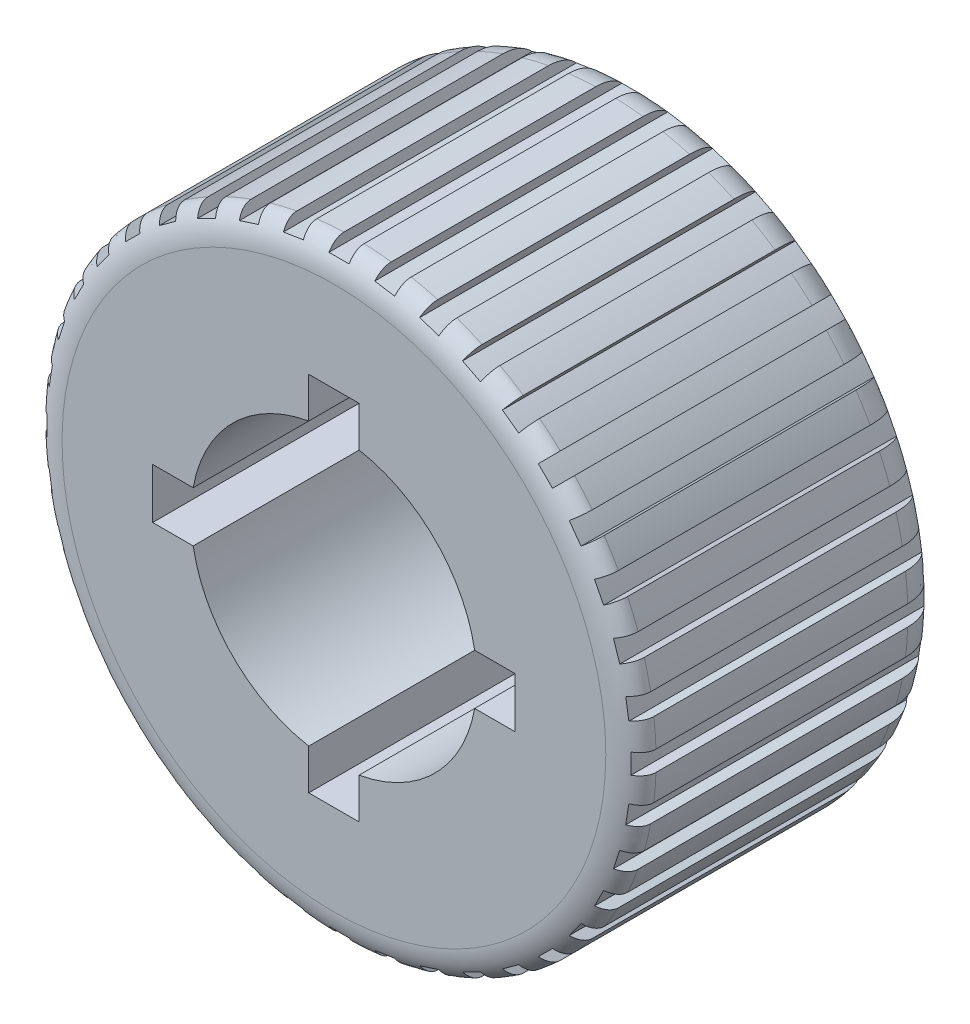
from build123d import *

# Parameters (mm, degrees)
ESBO_O1_R                = 30
ESBO_O1_R_2              = 10.7
RESSALTO_EXTRUS_O1_DEPTH = 30
ESBO_O2_R                = 14.2
ESBO_O2_R_2              = 10.7
CORTE_EXTRUS_O1_DEPTH    = 52.961524227
FILETE2_SIZE             = 2
FILETE2_SIZE_2           = 3
CORTE_EXTRUS_O2_DEPTH    = 52.9615244
CORTE_EXTRUS_O3_DEPTH    = 52.942275826


with BuildPart() as part:
    # Esboço1 → Ressalto-extrusão1 (new body)
    with BuildSketch(Plane.XY):
        Circle(ESBO_O1_R)
        Circle(ESBO_O1_R_2, mode=Mode.SUBTRACT)
    extrude(amount=RESSALTO_EXTRUS_O1_DEPTH)

    # Esboço2 → Corte-extrusão1 (cut, through all)
    with BuildSketch(Plane(origin=(0, 0, 0), x_dir=(-1, 0, 0), z_dir=(0, 0, -1))):
        Circle(ESBO_O2_R)
        Circle(ESBO_O2_R_2, mode=Mode.SUBTRACT)
    extrude(amount=-CORTE_EXTRUS_O1_DEPTH, mode=Mode.SUBTRACT)

    # Filete2
    # an asymmetric fillet: 3, 2 mm, written as the material it takes off along each edge
    with BuildSketch(Plane(origin=(0, 0, 30), x_dir=(1, 0, 0), z_dir=(0, -1, 0))) as filete2_piece_1:
        with BuildLine():
            Bezier((30, -FILETE2_SIZE), (30, 0), (30 - FILETE2_SIZE_2, 0), weights=[1, 0.707106781, 1])
            Line((30 - FILETE2_SIZE_2, 0), (30, 0))
            Line((30, 0), (30, -FILETE2_SIZE))
        make_face()
    revolve(axis=Axis((0, 0, 30), (0, 0, 1)), mode=Mode.SUBTRACT)
    with BuildSketch(Plane(origin=(0, 0, 0), x_dir=(1, 0, 0), z_dir=(0, -1, 0))) as filete2_piece_2:
        with BuildLine():
            Bezier((30, FILETE2_SIZE_2), (30, 0), (30 - FILETE2_SIZE, 0), weights=[1, 0.707106781, 1])
            Line((30 - FILETE2_SIZE, 0), (30, 0))
            Line((30, 0), (30, FILETE2_SIZE_2))
        make_face()
    revolve(axis=Axis((0, 0, 0), (0, 0, 1)), mode=Mode.SUBTRACT)

    # Esboço6 → Corte-extrusão2 (cut, through all)
    with BuildSketch(Plane.XY.offset(30)):
        with BuildLine():
            Line((5.521589879, 28.469493238), (5.678114326, 29.457749705))
            ThreePointArc((5.678114326, 29.457749705), (4.693033951, 29.630650218), (3.702737645, 29.770618635))
            Line((3.702737645, 29.770618635), (3.546213197, 28.782362168))
            ThreePointArc((3.546213197, 28.782362168), (4.536599486, 28.642961877), (5.521589879, 28.469493238))
        make_face()
        with BuildLine():
            Line((-1, 29.983328701), (-1, 28.982753492))
            ThreePointArc((-1, 28.982753492), (0, 29), (1, 28.982753492))
            Line((1, 28.982753492), (1, 29.983328701))
            ThreePointArc((1, 29.983328701), (0, 30), (-1, 29.983328701))
        make_face()
        with BuildLine():
            Line((9.907219889, 27.255219575), (10.216414633, 28.206823147))
            ThreePointArc((10.216414633, 28.206823147), (9.270509831, 28.531695489), (8.3143016, 28.824857136))
            Line((8.3143016, 28.824857136), (8.005106857, 27.873253563))
            ThreePointArc((8.005106857, 27.873253563), (8.961492837, 27.580638973), (9.907219889, 27.255219575))
        make_face()
        with BuildLine():
            Line((14.048901266, 25.369831951), (14.503152905, 26.26135099))
            ThreePointArc((14.503152905, 26.26135099), (13.619714992, 26.730195726), (12.721139857, 27.169331989))
            Line((12.721139857, 27.169331989), (12.266888218, 26.27781295))
            ThreePointArc((12.266888218, 26.27781295), (13.165724492, 25.839189201), (14.048901266, 25.369831951))
        make_face()
        with BuildLine():
            Line((17.844652068, 22.859754867), (18.43277542, 23.669237215))
            ThreePointArc((18.43277542, 23.669237215), (17.633557569, 24.270509831), (16.814741431, 24.844807719))
            Line((16.814741431, 24.844807719), (16.226618079, 24.035325371))
            ThreePointArc((16.226618079, 24.035325371), (17.045772316, 23.461492837), (17.844652068, 22.859754867))
        make_face()
        with BuildLine():
            Line((21.201008313, 19.786794751), (21.908521828, 20.494308266))
            ThreePointArc((21.908521828, 20.494308266), (21.213203436, 21.213203436), (20.494308266, 21.908521828))
            Line((20.494308266, 21.908521828), (19.786794751, 21.201008313))
            ThreePointArc((19.786794751, 21.201008313), (20.506096654, 20.506096654), (21.201008313, 19.786794751))
        make_face()
        with BuildLine():
            Line((24.035325371, 16.226618079), (24.844807719, 16.814741431))
            ThreePointArc((24.844807719, 16.814741431), (24.270509831, 17.633557569), (23.669237215, 18.43277542))
            Line((23.669237215, 18.43277542), (22.859754867, 17.844652068))
            ThreePointArc((22.859754867, 17.844652068), (23.461492837, 17.045772316), (24.035325371, 16.226618079))
        make_face()
        with BuildLine():
            Line((26.27781295, 12.266888218), (27.169331989, 12.721139857))
            ThreePointArc((27.169331989, 12.721139857), (26.730195726, 13.619714992), (26.26135099, 14.503152905))
            Line((26.26135099, 14.503152905), (25.369831951, 14.048901266))
            ThreePointArc((25.369831951, 14.048901266), (25.839189201, 13.165724492), (26.27781295, 12.266888218))
        make_face()
        with BuildLine():
            Line((27.873253563, 8.005106857), (28.824857136, 8.3143016))
            ThreePointArc((28.824857136, 8.3143016), (28.531695489, 9.270509831), (28.206823147, 10.216414633))
            Line((28.206823147, 10.216414633), (27.255219575, 9.907219889))
            ThreePointArc((27.255219575, 9.907219889), (27.580638973, 8.961492837), (27.873253563, 8.005106857))
        make_face()
        with BuildLine():
            Line((28.782362168, 3.546213197), (29.770618635, 3.702737645))
            ThreePointArc((29.770618635, 3.702737645), (29.630650218, 4.693033951), (29.457749705, 5.678114326))
            Line((29.457749705, 5.678114326), (28.469493238, 5.521589879))
            ThreePointArc((28.469493238, 5.521589879), (28.642961877, 4.536599486), (28.782362168, 3.546213197))
        make_face()
        with BuildLine():
            Line((28.982753492, -1), (29.983328701, -1))
            ThreePointArc((29.983328701, -1), (30, 0), (29.983328701, 1))
            Line((29.983328701, 1), (28.982753492, 1))
            ThreePointArc((28.982753492, 1), (29, 0), (28.982753492, -1))
        make_face()
        with BuildLine():
            Line((28.469493238, -5.521589879), (29.457749705, -5.678114326))
            ThreePointArc((29.457749705, -5.678114326), (29.630650218, -4.693033951), (29.770618635, -3.702737645))
            Line((29.770618635, -3.702737645), (28.782362168, -3.546213197))
            ThreePointArc((28.782362168, -3.546213197), (28.642961877, -4.536599486), (28.469493238, -5.521589879))
        make_face()
        with BuildLine():
            Line((27.255219575, -9.907219889), (28.206823147, -10.216414633))
            ThreePointArc((28.206823147, -10.216414633), (28.531695489, -9.270509831), (28.824857136, -8.3143016))
            Line((28.824857136, -8.3143016), (27.873253563, -8.005106857))
            ThreePointArc((27.873253563, -8.005106857), (27.580638973, -8.961492837), (27.255219575, -9.907219889))
        make_face()
        with BuildLine():
            Line((25.369831951, -14.048901266), (26.26135099, -14.503152905))
            ThreePointArc((26.26135099, -14.503152905), (26.730195726, -13.619714992), (27.169331989, -12.721139857))
            Line((27.169331989, -12.721139857), (26.27781295, -12.266888218))
            ThreePointArc((26.27781295, -12.266888218), (25.839189201, -13.165724492), (25.369831951, -14.048901266))
        make_face()
        with BuildLine():
            Line((22.859754867, -17.844652068), (23.669237215, -18.43277542))
            ThreePointArc((23.669237215, -18.43277542), (24.270509831, -17.633557569), (24.844807719, -16.814741431))
            Line((24.844807719, -16.814741431), (24.035325371, -16.226618079))
            ThreePointArc((24.035325371, -16.226618079), (23.461492837, -17.045772316), (22.859754867, -17.844652068))
        make_face()
        with BuildLine():
            Line((19.786794751, -21.201008313), (20.494308266, -21.908521828))
            ThreePointArc((20.494308266, -21.908521828), (21.213203436, -21.213203436), (21.908521828, -20.494308266))
            Line((21.908521828, -20.494308266), (21.201008313, -19.786794751))
            ThreePointArc((21.201008313, -19.786794751), (20.506096654, -20.506096654), (19.786794751, -21.201008313))
        make_face()
        with BuildLine():
            Line((16.226618079, -24.035325371), (16.814741431, -24.844807719))
            ThreePointArc((16.814741431, -24.844807719), (17.633557569, -24.270509831), (18.43277542, -23.669237215))
            Line((18.43277542, -23.669237215), (17.844652068, -22.859754867))
            ThreePointArc((17.844652068, -22.859754867), (17.045772316, -23.461492837), (16.226618079, -24.035325371))
        make_face()
        with BuildLine():
            Line((12.266888218, -26.27781295), (12.721139857, -27.169331989))
            ThreePointArc((12.721139857, -27.169331989), (13.619714992, -26.730195726), (14.503152905, -26.26135099))
            Line((14.503152905, -26.26135099), (14.048901266, -25.369831951))
            ThreePointArc((14.048901266, -25.369831951), (13.165724492, -25.839189201), (12.266888218, -26.27781295))
        make_face()
        with BuildLine():
            Line((8.005106857, -27.873253563), (8.3143016, -28.824857136))
            ThreePointArc((8.3143016, -28.824857136), (9.270509831, -28.531695489), (10.216414633, -28.206823147))
            Line((10.216414633, -28.206823147), (9.907219889, -27.255219575))
            ThreePointArc((9.907219889, -27.255219575), (8.961492837, -27.580638973), (8.005106857, -27.873253563))
        make_face()
        with BuildLine():
            Line((3.546213197, -28.782362168), (3.702737645, -29.770618635))
            ThreePointArc((3.702737645, -29.770618635), (4.693033951, -29.630650218), (5.678114326, -29.457749705))
            Line((5.678114326, -29.457749705), (5.521589879, -28.469493238))
            ThreePointArc((5.521589879, -28.469493238), (4.536599486, -28.642961877), (3.546213197, -28.782362168))
        make_face()
        with BuildLine():
            Line((-1, -28.982753492), (-1, -29.983328701))
            ThreePointArc((-1, -29.983328701), (0, -30), (1, -29.983328701))
            Line((1, -29.983328701), (1, -28.982753492))
            ThreePointArc((1, -28.982753492), (0, -29), (-1, -28.982753492))
        make_face()
        with BuildLine():
            Line((-5.521589879, -28.469493238), (-5.678114326, -29.457749705))
            ThreePointArc((-5.678114326, -29.457749705), (-4.693033951, -29.630650218), (-3.702737645, -29.770618635))
            Line((-3.702737645, -29.770618635), (-3.546213197, -28.782362168))
            ThreePointArc((-3.546213197, -28.782362168), (-4.536599486, -28.642961877), (-5.521589879, -28.469493238))
        make_face()
        with BuildLine():
            Line((-9.907219889, -27.255219575), (-10.216414633, -28.206823147))
            ThreePointArc((-10.216414633, -28.206823147), (-9.270509831, -28.531695489), (-8.3143016, -28.824857136))
            Line((-8.3143016, -28.824857136), (-8.005106857, -27.873253563))
            ThreePointArc((-8.005106857, -27.873253563), (-8.961492837, -27.580638973), (-9.907219889, -27.255219575))
        make_face()
        with BuildLine():
            Line((-14.048901266, -25.369831951), (-14.503152905, -26.26135099))
            ThreePointArc((-14.503152905, -26.26135099), (-13.619714992, -26.730195726), (-12.721139857, -27.169331989))
            Line((-12.721139857, -27.169331989), (-12.266888218, -26.27781295))
            ThreePointArc((-12.266888218, -26.27781295), (-13.165724492, -25.839189201), (-14.048901266, -25.369831951))
        make_face()
        with BuildLine():
            Line((-17.844652068, -22.859754867), (-18.43277542, -23.669237215))
            ThreePointArc((-18.43277542, -23.669237215), (-17.633557569, -24.270509831), (-16.814741431, -24.844807719))
            Line((-16.814741431, -24.844807719), (-16.226618079, -24.035325371))
            ThreePointArc((-16.226618079, -24.035325371), (-17.045772316, -23.461492837), (-17.844652068, -22.859754867))
        make_face()
        with BuildLine():
            Line((-21.201008313, -19.786794751), (-21.908521828, -20.494308266))
            ThreePointArc((-21.908521828, -20.494308266), (-21.213203436, -21.213203436), (-20.494308266, -21.908521828))
            Line((-20.494308266, -21.908521828), (-19.786794751, -21.201008313))
            ThreePointArc((-19.786794751, -21.201008313), (-20.506096654, -20.506096654), (-21.201008313, -19.786794751))
        make_face()
        with BuildLine():
            Line((-24.035325371, -16.226618079), (-24.844807719, -16.814741431))
            ThreePointArc((-24.844807719, -16.814741431), (-24.270509831, -17.633557569), (-23.669237215, -18.43277542))
            Line((-23.669237215, -18.43277542), (-22.859754867, -17.844652068))
            ThreePointArc((-22.859754867, -17.844652068), (-23.461492837, -17.045772316), (-24.035325371, -16.226618079))
        make_face()
        with BuildLine():
            Line((-26.27781295, -12.266888218), (-27.169331989, -12.721139857))
            ThreePointArc((-27.169331989, -12.721139857), (-26.730195726, -13.619714992), (-26.26135099, -14.503152905))
            Line((-26.26135099, -14.503152905), (-25.369831951, -14.048901266))
            ThreePointArc((-25.369831951, -14.048901266), (-25.839189201, -13.165724492), (-26.27781295, -12.266888218))
        make_face()
        with BuildLine():
            Line((-27.873253563, -8.005106857), (-28.824857136, -8.3143016))
            ThreePointArc((-28.824857136, -8.3143016), (-28.531695489, -9.270509831), (-28.206823147, -10.216414633))
            Line((-28.206823147, -10.216414633), (-27.255219575, -9.907219889))
            ThreePointArc((-27.255219575, -9.907219889), (-27.580638973, -8.961492837), (-27.873253563, -8.005106857))
        make_face()
        with BuildLine():
            Line((-28.782362168, -3.546213197), (-29.770618635, -3.702737645))
            ThreePointArc((-29.770618635, -3.702737645), (-29.630650218, -4.693033951), (-29.457749705, -5.678114326))
            Line((-29.457749705, -5.678114326), (-28.469493238, -5.521589879))
            ThreePointArc((-28.469493238, -5.521589879), (-28.642961877, -4.536599486), (-28.782362168, -3.546213197))
        make_face()
        with BuildLine():
            Line((-28.982753492, 1), (-29.983328701, 1))
            ThreePointArc((-29.983328701, 1), (-30, 0), (-29.983328701, -1))
            Line((-29.983328701, -1), (-28.982753492, -1))
            ThreePointArc((-28.982753492, -1), (-29, 0), (-28.982753492, 1))
        make_face()
        with BuildLine():
            Line((-28.469493238, 5.521589879), (-29.457749705, 5.678114326))
            ThreePointArc((-29.457749705, 5.678114326), (-29.630650218, 4.693033951), (-29.770618635, 3.702737645))
            Line((-29.770618635, 3.702737645), (-28.782362168, 3.546213197))
            ThreePointArc((-28.782362168, 3.546213197), (-28.642961877, 4.536599486), (-28.469493238, 5.521589879))
        make_face()
        with BuildLine():
            Line((-27.255219575, 9.907219889), (-28.206823147, 10.216414633))
            ThreePointArc((-28.206823147, 10.216414633), (-28.531695489, 9.270509831), (-28.824857136, 8.3143016))
            Line((-28.824857136, 8.3143016), (-27.873253563, 8.005106857))
            ThreePointArc((-27.873253563, 8.005106857), (-27.580638973, 8.961492837), (-27.255219575, 9.907219889))
        make_face()
        with BuildLine():
            Line((-25.369831951, 14.048901266), (-26.26135099, 14.503152905))
            ThreePointArc((-26.26135099, 14.503152905), (-26.730195726, 13.619714992), (-27.169331989, 12.721139857))
            Line((-27.169331989, 12.721139857), (-26.27781295, 12.266888218))
            ThreePointArc((-26.27781295, 12.266888218), (-25.839189201, 13.165724492), (-25.369831951, 14.048901266))
        make_face()
        with BuildLine():
            Line((-22.859754867, 17.844652068), (-23.669237215, 18.43277542))
            ThreePointArc((-23.669237215, 18.43277542), (-24.270509831, 17.633557569), (-24.844807719, 16.814741431))
            Line((-24.844807719, 16.814741431), (-24.035325371, 16.226618079))
            ThreePointArc((-24.035325371, 16.226618079), (-23.461492837, 17.045772316), (-22.859754867, 17.844652068))
        make_face()
        with BuildLine():
            Line((-19.786794751, 21.201008313), (-20.494308266, 21.908521828))
            ThreePointArc((-20.494308266, 21.908521828), (-21.213203436, 21.213203436), (-21.908521828, 20.494308266))
            Line((-21.908521828, 20.494308266), (-21.201008313, 19.786794751))
            ThreePointArc((-21.201008313, 19.786794751), (-20.506096654, 20.506096654), (-19.786794751, 21.201008313))
        make_face()
        with BuildLine():
            Line((-16.226618079, 24.035325371), (-16.814741431, 24.844807719))
            ThreePointArc((-16.814741431, 24.844807719), (-17.633557569, 24.270509831), (-18.43277542, 23.669237215))
            Line((-18.43277542, 23.669237215), (-17.844652068, 22.859754867))
            ThreePointArc((-17.844652068, 22.859754867), (-17.045772316, 23.461492837), (-16.226618079, 24.035325371))
        make_face()
        with BuildLine():
            Line((-12.266888218, 26.27781295), (-12.721139857, 27.169331989))
            ThreePointArc((-12.721139857, 27.169331989), (-13.619714992, 26.730195726), (-14.503152905, 26.26135099))
            Line((-14.503152905, 26.26135099), (-14.048901266, 25.369831951))
            ThreePointArc((-14.048901266, 25.369831951), (-13.165724492, 25.839189201), (-12.266888218, 26.27781295))
        make_face()
        with BuildLine():
            Line((-8.005106857, 27.873253563), (-8.3143016, 28.824857136))
            ThreePointArc((-8.3143016, 28.824857136), (-9.270509831, 28.531695489), (-10.216414633, 28.206823147))
            Line((-10.216414633, 28.206823147), (-9.907219889, 27.255219575))
            ThreePointArc((-9.907219889, 27.255219575), (-8.961492837, 27.580638973), (-8.005106857, 27.873253563))
        make_face()
        with BuildLine():
            Line((-3.546213197, 28.782362168), (-3.702737645, 29.770618635))
            ThreePointArc((-3.702737645, 29.770618635), (-4.693033951, 29.630650218), (-5.678114326, 29.457749705))
            Line((-5.678114326, 29.457749705), (-5.521589879, 28.469493238))
            ThreePointArc((-5.521589879, 28.469493238), (-4.536599486, 28.642961877), (-3.546213197, 28.782362168))
        make_face()
    extrude(amount=-CORTE_EXTRUS_O2_DEPTH, mode=Mode.SUBTRACT)

    # Esboço7 → Corte-extrusão3 (cut, through all)
    with BuildSketch(Plane(origin=(0, 0, 0), x_dir=(-1, 0, 0), z_dir=(0, 0, -1))):
        with BuildLine():
            Line((18, 0), (18, 2.5))
            Line((18, 2.5), (13.978197309, 2.5))
            ThreePointArc((13.978197309, 2.5), (14.2, 0), (13.978197309, -2.5))
            Line((13.978197309, -2.5), (18, -2.5))
            Line((18, -2.5), (18, 0))
        make_face()
        with BuildLine():
            Line((0, 18), (-2.5, 18))
            Line((-2.5, 18), (-2.5, 13.978197309))
            ThreePointArc((-2.5, 13.978197309), (0, 14.2), (2.5, 13.978197309))
            Line((2.5, 13.978197309), (2.5, 18))
            Line((2.5, 18), (0, 18))
        make_face()
        with BuildLine():
            Line((2.5, -18), (2.5, -13.978197309))
            ThreePointArc((2.5, -13.978197309), (0, -14.2), (-2.5, -13.978197309))
            Line((-2.5, -13.978197309), (-2.5, -18))
            Line((-2.5, -18), (0, -18))
            Line((0, -18), (2.5, -18))
        make_face()
        with BuildLine():
            Line((-18, -2.5), (-13.978197309, -2.5))
            ThreePointArc((-13.978197309, -2.5), (-14.2, 0), (-13.978197309, 2.5))
            Line((-13.978197309, 2.5), (-18, 2.5))
            Line((-18, 2.5), (-18, 0))
            Line((-18, 0), (-18, -2.5))
        make_face()
    extrude(amount=-CORTE_EXTRUS_O3_DEPTH, mode=Mode.SUBTRACT)


solid = part.part
